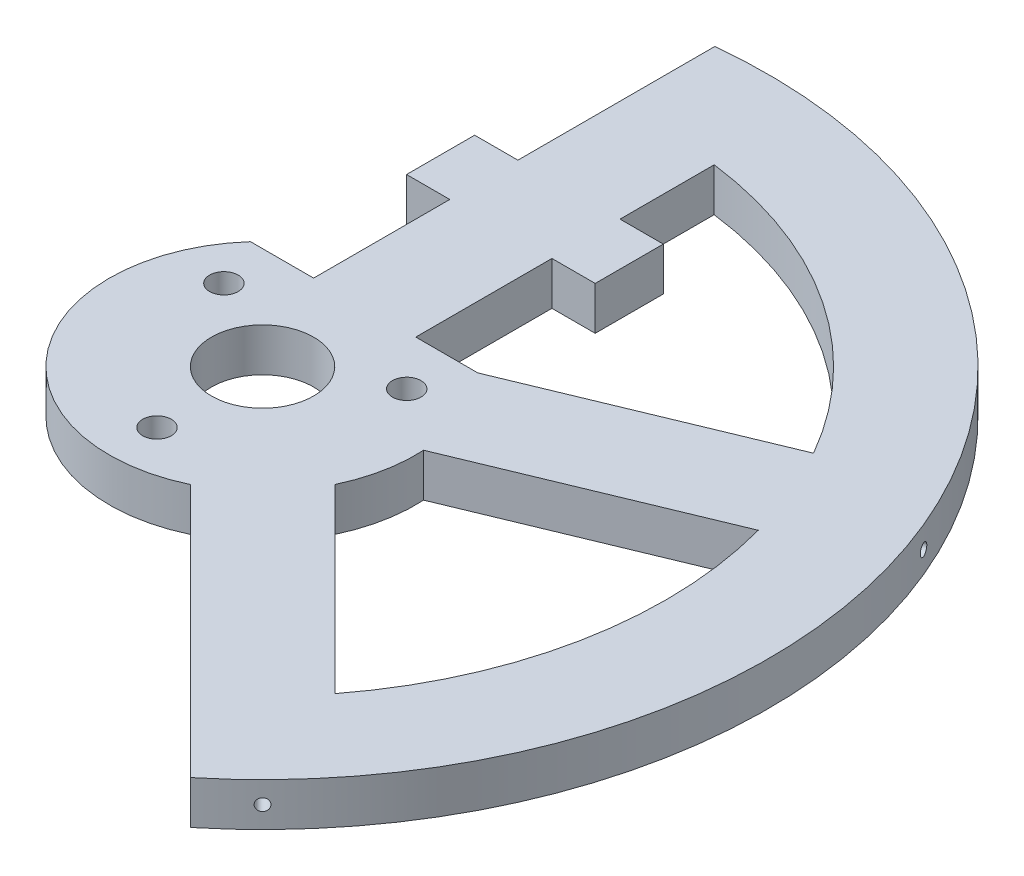
from build123d import *

# Parameters (mm, degrees)
SKETCH1_R             = 7.5
BOSS_EXTRUDE1_DEPTH   = 3.175
M5X0_8_TAPPED_HOLE2_D = 4.2
CIRPATTERN1_COUNT     = 3
CIRPATTERN1_ANGLE     = 135


with BuildPart() as part:
    # Sketch1 → Boss-Extrude1 (new, symmetric)
    with BuildSketch(Plane(origin=(0, 0, 0), x_dir=(1, 0, 0), z_dir=(0, 1, 0))):
        with BuildLine():
            Line((-13.85, 45), (-13.85, 35))
            Line((-13.85, 35), (-7.5, 35))
            Line((-7.5, 35), (-7.5, 15))
            Line((-7.5, 15), (-16.770509831, 15))
            ThreePointArc((-16.770509831, 15), (-18.002512666, -13.496649128), (9.696699141, -20.303300859))
            Line((9.696699141, -20.303300859), (46.966384428, -57.572986146))
            ThreePointArc((46.966384428, -57.572986146), (71.03695878, -21.777063329), (71.163760724, 21.359053339))
            ThreePointArc((71.163760724, 21.359053339), (68.644249266, 28.433379025), (65.423509239, 35.217246327))
            ThreePointArc((65.423509239, 35.217246327), (34.832006114, 65.629424423), (-7.5, 73.920497834))
            Line((-7.5, 73.920497834), (-7.5, 45))
            Line((-7.5, 45), (-13.85, 45))
        make_face()
        Circle(SKETCH1_R, mode=Mode.SUBTRACT)
        with BuildLine():
            Line((46.898012061, -36.291410343), (20.303300859, -9.696699141))
            ThreePointArc((20.303300859, -9.696699141), (22.067668809, -4.389532245), (22.468570216, 1.188845008))
            Line((22.468570216, 1.188845008), (57.216234934, 15.581798996))
            ThreePointArc((57.216234934, 15.581798996), (58.160567128, -11.568856096), (46.898012061, -36.291410343))
        make_face(mode=Mode.SUBTRACT)
        with BuildLine():
            Line((16.614758962, 15), (7.5, 15))
            Line((7.5, 15), (7.5, 35))
            Line((7.5, 35), (13.85, 35))
            Line((13.85, 35), (13.85, 45))
            Line((13.85, 45), (7.5, 45))
            Line((7.5, 45), (7.5, 58.823804705))
            ThreePointArc((7.5, 58.823804705), (32.945314818, 49.30614801), (51.475983449, 29.439991983))
            Line((51.475983449, 29.439991983), (16.72831873, 15.047037996))
            Line((16.72831873, 15.047037996), (16.614758962, 15))
        make_face(mode=Mode.SUBTRACT)
    extrude(amount=BOSS_EXTRUDE1_DEPTH, both=True)

    # M5x0.8 Tapped Hole2 (through all)
    with Locations(Plane(origin=(0, 3.175, 0), x_dir=(1, 0, 0), z_dir=(0, 1, 0))):
        with Locations((0, -15.5), (-13.423393759, 7.75), (13.423393759, 7.75)):
            Hole(M5X0_8_TAPPED_HOLE2_D / 2)

    # Sketch5 → M2.2x0.45 Tapped Hole1 (revolve, cut)
    with BuildSketch(Plane(origin=(0, 0, -74.3), x_dir=(0, 1, 0), z_dir=(1, 0, 0))):
        Polygon((0, 0), (0, 10.525753042), (0.875, 10), (0.875, 0), align=None)
    m2_2x0_45_tapped_hole1 = revolve(axis=Axis((0, 0, -80.65), (0, 0, 1)), mode=Mode.SUBTRACT)

    # CirPattern1: M2.2x0.45 Tapped Hole1 ×3 about axis
    cirpattern1_axis = Axis((0, 3.175, 0), (0, -1, 0))
    for i in range(1, CIRPATTERN1_COUNT):
        add(m2_2x0_45_tapped_hole1.rotate(cirpattern1_axis, i * CIRPATTERN1_ANGLE / (CIRPATTERN1_COUNT - 1)), mode=Mode.SUBTRACT)


solid = part.part
